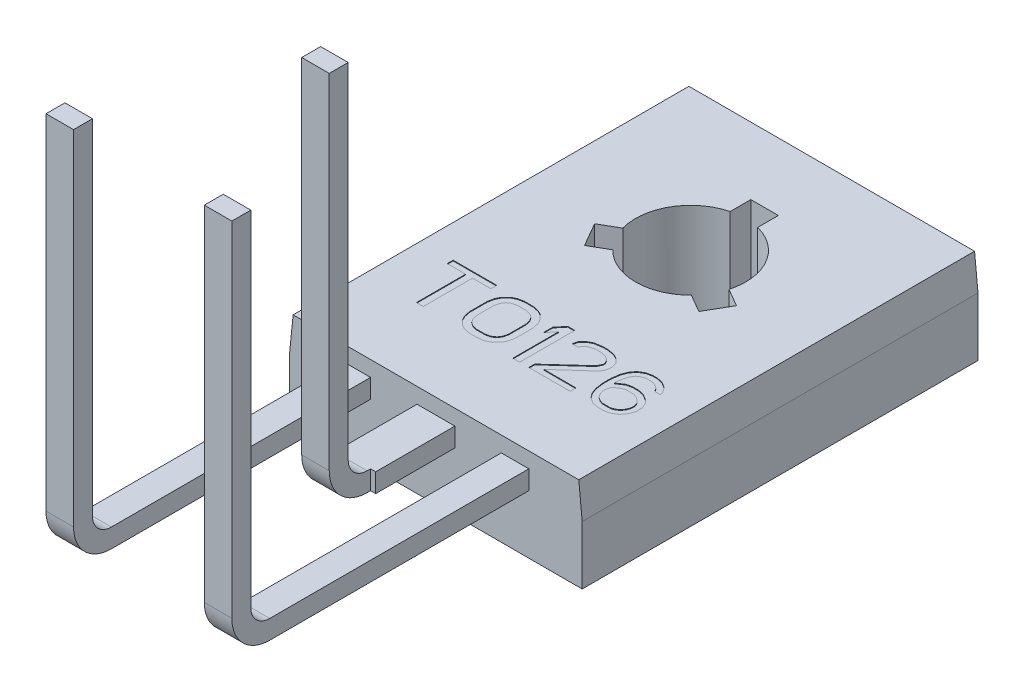
from build123d import *

# Parameters (mm, degrees)
CORTAR_EXTRUIR1_START         = -2.25
CORTAR_EXTRUIR1_OUTLINE_W     = 8.5
CORTAR_EXTRUIR1_OUTLINE_H     = 11.5
CORTAR_EXTRUIR1_DEPTH         = 2.68
CORTAR_EXTRUIR1_START_2       = -0.55
CORTAR_EXTRUIR1_2_OUTLINE_W   = 0.8
CORTAR_EXTRUIR1_2_OUTLINE_H   = 15.8
CORTAR_EXTRUIR1_2_OUTLINE_W_2 = 1.1
CORTAR_EXTRUIR1_2_OUTLINE_H_2 = 2.3
CORTAR_EXTRUIR1_2_DEPTH       = 0.55
CORTAR_EXTRUIR1_START_3       = -2.27
CORTAR_EXTRUIR1_3_OUTLINE_W   = 6.9
CORTAR_EXTRUIR1_3_OUTLINE_H   = 8.7
CORTAR_EXTRUIR1_3_DEPTH       = 2.72
CORTAR_EXTRUIR1_4_DEPTH       = 0.7
CORTAR_EXTRUIR1_START_4       = 0.43
CORTAR_EXTRUIR1_5_OUTLINE_W   = 8.5
CORTAR_EXTRUIR1_5_OUTLINE_H   = 11.5
CORTAR_EXTRUIR1_5_OUTLINE_W_2 = 6.9
CORTAR_EXTRUIR1_5_OUTLINE_H_2 = 8.7
CORTAR_EXTRUIR1_5_DEPTH       = 0.02
CORTAR_EXTRUIR1_6_DEPTH       = 0.02
CORTAR_EXTRUIR1_START_5       = -12
CORTAR_EXTRUIR1_7_DEPTH       = 13
CROQUIS4_W                    = 5.4
CROQUIS4_H                    = 11.5
CORTAR_EXTRUIR2_DEPTH         = 17.518335267
SALIENTE_EXTRUIR2_DEPTH       = 0.4
SALIENTE_EXTRUIR3_DEPTH       = 0.4
SALIENTE_EXTRUIR4_DEPTH       = 0.4


with BuildPart() as part:
    # Cortar-Extruir1: read off the stored shape, not the designer's step
    # Cortar-Extruir1 outline → Cortar-Extruir1 (new body)
    with BuildSketch(Plane(origin=(0, 2.25, 0), x_dir=(1, 0, 0), z_dir=(0, 1, 0)).offset(CORTAR_EXTRUIR1_START)):
        with Locations((0, 5.75)):
            Rectangle(CORTAR_EXTRUIR1_OUTLINE_W, CORTAR_EXTRUIR1_OUTLINE_H)
        with BuildLine():
            Line((-1.661256029, 5.978993169), (-2.061256029, 6.671813492))
            Line((-2.061256029, 6.671813492), (-1.541640786, 6.971813492))
            ThreePointArc((-1.541640786, 6.971813492), (-1.385640646, 8.2), (-0.4, 8.949193338))
            Line((-0.4, 8.949193338), (-0.4, 9.549193338))
            Line((-0.4, 9.549193338), (0.4, 9.549193338))
            Line((0.4, 9.549193338), (0.4, 8.949193338))
            ThreePointArc((0.4, 8.949193338), (1.385640646, 8.2), (1.541640786, 6.971813492))
            Line((1.541640786, 6.971813492), (2.061256029, 6.671813492))
            Line((2.061256029, 6.671813492), (1.661256029, 5.978993169))
            Line((1.661256029, 5.978993169), (1.141640787, 6.278993169))
            ThreePointArc((1.141640787, 6.278993169), (0, 5.8), (-1.141640787, 6.278993169))
            Line((-1.141640787, 6.278993169), (-1.661256029, 5.978993169))
        make_face(mode=Mode.SUBTRACT)
    extrude(amount=CORTAR_EXTRUIR1_DEPTH)

    # Cortar-Extruir1 2 outline → Cortar-Extruir1 2 (add)
    with BuildSketch(Plane(origin=(0, 2.25, 0), x_dir=(1, 0, 0), z_dir=(0, 1, 0)).offset(CORTAR_EXTRUIR1_START_2)):
        with Locations((-2.3, -7.9)):
            Rectangle(CORTAR_EXTRUIR1_2_OUTLINE_W, CORTAR_EXTRUIR1_2_OUTLINE_H)
        with Locations((0, -1.15)):
            Rectangle(CORTAR_EXTRUIR1_2_OUTLINE_W_2, CORTAR_EXTRUIR1_2_OUTLINE_H_2)
        with Locations((2.3, -7.9)):
            Rectangle(CORTAR_EXTRUIR1_2_OUTLINE_W, CORTAR_EXTRUIR1_2_OUTLINE_H)
    extrude(amount=CORTAR_EXTRUIR1_2_DEPTH)

    # Cortar-Extruir1 3 outline → Cortar-Extruir1 3 (add)
    # profile 1 of 3: a face of its own
    with BuildSketch(Plane(origin=(0, 2.25, 0), x_dir=(1, 0, 0), z_dir=(0, 1, 0)).offset(CORTAR_EXTRUIR1_START_3)):
        with Locations((0, 6.35)):
            Rectangle(CORTAR_EXTRUIR1_3_OUTLINE_W, CORTAR_EXTRUIR1_3_OUTLINE_H)
        Polygon((-1.933333302, 3.7), (-1.933333302, 3.529787254), (-2.466666651, 3.529787254), (-2.466666651, 2.1), (-2.666666651, 2.1), (-2.666666651, 3.529787254), (-3.2, 3.529787254), (-3.2, 3.7), align=None, mode=Mode.SUBTRACT)
        Polygon((-1.133333397, 3.7), (-0.866666603, 3.7), (-0.7, 3.665957451), (-0.566666603, 3.597872353), (-0.433333397, 3.461702156), (-0.366666603, 3.32553196), (-0.333333397, 3.155319118), (-0.333333397, 2.644680834), (-0.366666603, 2.474468088), (-0.433333397, 2.338297868), (-0.566666603, 2.202127659), (-0.7, 2.134042552), (-0.866666603, 2.1), (-1.133333397, 2.1), (-1.3, 2.134042552), (-1.433333397, 2.202127659), (-1.566666603, 2.338297868), (-1.633333302, 2.474468088), (-1.666666698, 2.644680834), (-1.666666698, 3.155319118), (-1.633333302, 3.32553196), (-1.566666603, 3.461702156), (-1.433333397, 3.597872353), (-1.3, 3.665957451), align=None, mode=Mode.SUBTRACT)
        Polygon((0.333333206, 2.1), (0.133333206, 2.1), (0.133333206, 3.427659607), (-0.066666603, 3.189361668), (-0.066666603, 3.461702156), (0.133333206, 3.7), (0.333333206, 3.7), align=None, mode=Mode.SUBTRACT)
        Polygon((0.6, 2.27021277), (1.533333206, 3.121276569), (1.6, 3.257446766), (1.6, 3.32553196), (1.533333206, 3.427659607), (1.433333206, 3.495744705), (1.266666794, 3.529787254), (1.133333206, 3.529787254), (0.966666794, 3.495744705), (0.866666794, 3.427659607), (0.8, 3.32553196), (0.633333206, 3.32553196), (0.666666794, 3.461702156), (0.8, 3.597872353), (0.933333206, 3.665957451), (1.166666794, 3.7), (1.3, 3.7), (1.5, 3.665957451), (1.633333206, 3.597872353), (1.766666794, 3.461702156), (1.8, 3.32553196), (1.8, 3.257446766), (1.766666794, 3.121276569), (1.7, 3.019148922), (0.866666794, 2.27021277), (1.8, 2.27021277), (1.8, 2.1), (0.6, 2.1), align=None, mode=Mode.SUBTRACT)
        Polygon((3.2, 2.882978725), (3.266666412, 2.71276598), (3.266666412, 2.542553186), (3.2, 2.372340417), (3.1, 2.236170208), (2.933333206, 2.134042552), (2.766666794, 2.1), (2.6, 2.1), (2.433333206, 2.134042552), (2.266666794, 2.236170208), (2.166666794, 2.372340417), (2.1, 2.542553186), (2.066666794, 2.780851078), (2.066666794, 3.019148922), (2.1, 3.257446766), (2.166666794, 3.427659607), (2.266666794, 3.563829803), (2.433333206, 3.665957451), (2.6, 3.7), (2.733333206, 3.7), (2.9, 3.665957451), (3.066666794, 3.563829803), (3.166666794, 3.427659607), (3.2, 3.32553196), (3.033333206, 3.32553196), (2.966666794, 3.427659607), (2.866666794, 3.495744705), (2.766666794, 3.529787254), (2.566666794, 3.529787254), (2.466666794, 3.495744705), (2.366666794, 3.427659607), (2.3, 3.32553196), (2.266666794, 3.223404217), (2.233333206, 3.019148922), (2.233333206, 2.951063824), (2.433333206, 3.08723402), (2.6, 3.121276569), (2.766666794, 3.121276569), (2.933333206, 3.08723402), (3.1, 2.985106373), align=None, mode=Mode.SUBTRACT)
        with BuildLine():
            Line((-1.661256029, 5.978993169), (-2.061256029, 6.671813492))
            Line((-2.061256029, 6.671813492), (-1.985357107, 6.715633755))
            ThreePointArc((-1.985357107, 6.715633755), (-1.818653348, 8.45), (-0.4, 9.461552813))
            Line((-0.4, 9.461552813), (-0.4, 9.549193338))
            Line((-0.4, 9.549193338), (0.4, 9.549193338))
            Line((0.4, 9.549193338), (0.4, 9.461552813))
            ThreePointArc((0.4, 9.461552813), (1.818653348, 8.45), (1.985357107, 6.715633755))
            Line((1.985357107, 6.715633755), (2.061256029, 6.671813492))
            Line((2.061256029, 6.671813492), (1.661256029, 5.978993169))
            Line((1.661256029, 5.978993169), (1.585357107, 6.022813432))
            ThreePointArc((1.585357107, 6.022813432), (0, 5.3), (-1.585357107, 6.022813432))
            Line((-1.585357107, 6.022813432), (-1.661256029, 5.978993169))
        make_face(mode=Mode.SUBTRACT)
    # profile 2 of 3: a face of its own
    with BuildSketch(Plane(origin=(0, 2.25, 0), x_dir=(1, 0, 0), z_dir=(0, 1, 0)).offset(CORTAR_EXTRUIR1_START_3)):
        Polygon((-0.733333397, 3.461702156), (-0.866666603, 3.495744705), (-1.133333397, 3.495744705), (-1.266666603, 3.461702156), (-1.366666603, 3.393617058), (-1.433333397, 3.291489315), (-1.466666603, 3.155319119), (-1.466666603, 2.644680834), (-1.433333397, 2.508510637), (-1.366666603, 2.40638299), (-1.266666603, 2.338297868), (-1.133333397, 2.304255319), (-0.866666603, 2.304255319), (-0.733333397, 2.338297868), (-0.633333397, 2.40638299), (-0.566666603, 2.508510637), (-0.533333397, 2.644680834), (-0.533333397, 3.155319119), (-0.566666603, 3.291489315), (-0.633333397, 3.393617058), align=None)
    # profile 3 of 3: a face of its own
    with BuildSketch(Plane(origin=(0, 2.25, 0), x_dir=(1, 0, 0), z_dir=(0, 1, 0)).offset(CORTAR_EXTRUIR1_START_3)):
        Polygon((3.1, 2.576595736), (3.1, 2.678723383), (3.066666794, 2.780851078), (3, 2.848936176), (2.9, 2.917021275), (2.8, 2.951063824), (2.566666794, 2.951063824), (2.466666794, 2.917021275), (2.366666794, 2.848936176), (2.3, 2.780851078), (2.266666794, 2.678723383), (2.266666794, 2.576595736), (2.3, 2.474468088), (2.366666794, 2.372340417), (2.466666794, 2.304255319), (2.566666794, 2.27021277), (2.8, 2.27021277), (2.9, 2.304255319), (3, 2.372340417), (3.066666794, 2.474468088), align=None)
    extrude(amount=CORTAR_EXTRUIR1_3_DEPTH)

    # Cortar-Extruir1 4 outline → Cortar-Extruir1 4 (add)
    with BuildSketch(Plane(origin=(0, 2.25, 0), x_dir=(1, 0, 0), z_dir=(0, 1, 0)).offset(CORTAR_EXTRUIR1_START)):
        with BuildLine():
            Line((-2.061256029, 6.671813492), (-1.661256029, 5.978993169))
            Line((-1.661256029, 5.978993169), (-1.141640787, 6.278993169))
            ThreePointArc((-1.141640787, 6.278993169), (-1.385640646, 6.6), (-1.541640786, 6.971813492))
            Line((-1.541640786, 6.971813492), (-2.061256029, 6.671813492))
        make_face()
        with BuildLine():
            Line((-0.4, 9.549193338), (-0.4, 8.949193338))
            ThreePointArc((-0.4, 8.949193338), (0, 9), (0.4, 8.949193338))
            Line((0.4, 8.949193338), (0.4, 9.549193338))
            Line((0.4, 9.549193338), (-0.4, 9.549193338))
        make_face()
        with BuildLine():
            Line((1.141640787, 6.278993169), (1.661256029, 5.978993169))
            Line((1.661256029, 5.978993169), (2.061256029, 6.671813492))
            Line((2.061256029, 6.671813492), (1.541640786, 6.971813492))
            ThreePointArc((1.541640786, 6.971813492), (1.385640646, 6.6), (1.141640787, 6.278993169))
        make_face()
    extrude(amount=CORTAR_EXTRUIR1_4_DEPTH)

    # Cortar-Extruir1 5 outline → Cortar-Extruir1 5 (add)
    # profile 1 of 4: a face of its own
    with BuildSketch(Plane(origin=(0, 2.25, 0), x_dir=(1, 0, 0), z_dir=(0, 1, 0)).offset(CORTAR_EXTRUIR1_START_4)):
        with Locations((0, 5.75)):
            Rectangle(CORTAR_EXTRUIR1_5_OUTLINE_W, CORTAR_EXTRUIR1_5_OUTLINE_H)
        with Locations((0, 6.35)):
            Rectangle(CORTAR_EXTRUIR1_5_OUTLINE_W_2, CORTAR_EXTRUIR1_5_OUTLINE_H_2, mode=Mode.SUBTRACT)
    # profile 2 of 4: a face of its own
    with BuildSketch(Plane(origin=(0, 2.25, 0), x_dir=(1, 0, 0), z_dir=(0, 1, 0)).offset(CORTAR_EXTRUIR1_START_4)):
        with BuildLine():
            ThreePointArc((-0.4, 9.461552813), (-1.818653348, 8.45), (-1.985357107, 6.715633755))
            Line((-1.985357107, 6.715633755), (-1.541640786, 6.971813492))
            ThreePointArc((-1.541640786, 6.971813492), (-1.385640646, 8.2), (-0.4, 8.949193338))
            Line((-0.4, 8.949193338), (-0.4, 9.461552813))
        make_face()
    # profile 3 of 4: a face of its own
    with BuildSketch(Plane(origin=(0, 2.25, 0), x_dir=(1, 0, 0), z_dir=(0, 1, 0)).offset(CORTAR_EXTRUIR1_START_4)):
        with BuildLine():
            Line((-1.141640787, 6.278993169), (-1.585357107, 6.022813432))
            ThreePointArc((-1.585357107, 6.022813432), (0, 5.3), (1.585357107, 6.022813432))
            Line((1.585357107, 6.022813432), (1.141640787, 6.278993169))
            ThreePointArc((1.141640787, 6.278993169), (0, 5.8), (-1.141640787, 6.278993169))
        make_face()
    # profile 4 of 4: a face of its own
    with BuildSketch(Plane(origin=(0, 2.25, 0), x_dir=(1, 0, 0), z_dir=(0, 1, 0)).offset(CORTAR_EXTRUIR1_START_4)):
        with BuildLine():
            ThreePointArc((1.985357107, 6.715633755), (1.818653348, 8.45), (0.4, 9.461552813))
            Line((0.4, 9.461552813), (0.4, 8.949193338))
            ThreePointArc((0.4, 8.949193338), (1.385640646, 8.2), (1.541640786, 6.971813492))
            Line((1.541640786, 6.971813492), (1.985357107, 6.715633755))
        make_face()
    extrude(amount=CORTAR_EXTRUIR1_5_DEPTH)

    # Cortar-Extruir1 6 outline → Cortar-Extruir1 6 (add)
    # profile 1 of 8: a face of its own
    with BuildSketch(Plane(origin=(0, 2.25, 0), x_dir=(1, 0, 0), z_dir=(0, 1, 0)).offset(CORTAR_EXTRUIR1_START_3)):
        with BuildLine():
            Line((-1.985357107, 6.715633755), (-2.061256029, 6.671813492))
            Line((-2.061256029, 6.671813492), (-1.661256029, 5.978993169))
            Line((-1.661256029, 5.978993169), (-1.585357107, 6.022813432))
            ThreePointArc((-1.585357107, 6.022813432), (-1.818653348, 6.35), (-1.985357107, 6.715633755))
        make_face()
    # profile 2 of 8: a face of its own
    with BuildSketch(Plane(origin=(0, 2.25, 0), x_dir=(1, 0, 0), z_dir=(0, 1, 0)).offset(CORTAR_EXTRUIR1_START_3)):
        with BuildLine():
            Line((-0.4, 9.549193338), (-0.4, 9.461552813))
            ThreePointArc((-0.4, 9.461552813), (0, 9.5), (0.4, 9.461552813))
            Line((0.4, 9.461552813), (0.4, 9.549193338))
            Line((0.4, 9.549193338), (-0.4, 9.549193338))
        make_face()
    # profile 3 of 8: a face of its own
    with BuildSketch(Plane(origin=(0, 2.25, 0), x_dir=(1, 0, 0), z_dir=(0, 1, 0)).offset(CORTAR_EXTRUIR1_START_3)):
        with BuildLine():
            ThreePointArc((1.985357107, 6.715633755), (1.818653348, 6.35), (1.585357107, 6.022813432))
            Line((1.585357107, 6.022813432), (1.661256029, 5.978993169))
            Line((1.661256029, 5.978993169), (2.061256029, 6.671813492))
            Line((2.061256029, 6.671813492), (1.985357107, 6.715633755))
        make_face()
    # profile 4 of 8: a face of its own
    with BuildSketch(Plane(origin=(0, 2.25, 0), x_dir=(1, 0, 0), z_dir=(0, 1, 0)).offset(CORTAR_EXTRUIR1_START_3)):
        Polygon((-2.466666651, 3.529787254), (-1.933333302, 3.529787254), (-1.933333302, 3.7), (-3.2, 3.7), (-3.2, 3.529787254), (-2.666666651, 3.529787254), (-2.666666651, 2.1), (-2.466666651, 2.1), align=None)
    # profile 5 of 8: a face of its own
    with BuildSketch(Plane(origin=(0, 2.25, 0), x_dir=(1, 0, 0), z_dir=(0, 1, 0)).offset(CORTAR_EXTRUIR1_START_3)):
        Polygon((-0.7, 3.665957451), (-0.866666603, 3.7), (-1.133333397, 3.7), (-1.3, 3.665957451), (-1.433333397, 3.597872353), (-1.566666603, 3.461702156), (-1.633333302, 3.32553196), (-1.666666698, 3.155319118), (-1.666666698, 2.644680834), (-1.633333302, 2.474468088), (-1.566666603, 2.338297868), (-1.433333397, 2.202127659), (-1.3, 2.134042552), (-1.133333397, 2.1), (-0.866666603, 2.1), (-0.7, 2.134042552), (-0.566666603, 2.202127659), (-0.433333397, 2.338297868), (-0.366666603, 2.474468088), (-0.333333397, 2.644680834), (-0.333333397, 3.155319119), (-0.366666603, 3.32553196), (-0.433333397, 3.461702156), (-0.566666603, 3.597872353), align=None)
        Polygon((-1.133333397, 3.495744705), (-0.866666603, 3.495744705), (-0.733333397, 3.461702156), (-0.633333397, 3.393617058), (-0.566666603, 3.291489315), (-0.533333397, 3.155319118), (-0.533333397, 2.644680834), (-0.566666603, 2.508510637), (-0.633333397, 2.40638299), (-0.733333397, 2.338297868), (-0.866666603, 2.304255319), (-1.133333397, 2.304255319), (-1.266666603, 2.338297868), (-1.366666603, 2.40638299), (-1.433333397, 2.508510637), (-1.466666603, 2.644680834), (-1.466666603, 3.155319119), (-1.433333397, 3.291489315), (-1.366666603, 3.393617058), (-1.266666603, 3.461702156), align=None, mode=Mode.SUBTRACT)
    # profile 6 of 8: a face of its own
    with BuildSketch(Plane(origin=(0, 2.25, 0), x_dir=(1, 0, 0), z_dir=(0, 1, 0)).offset(CORTAR_EXTRUIR1_START_3)):
        Polygon((0.133333206, 3.427659607), (0.133333206, 2.1), (0.333333206, 2.1), (0.333333206, 3.7), (0.133333206, 3.7), (-0.066666603, 3.461702156), (-0.066666603, 3.189361668), align=None)
    # profile 7 of 8: a face of its own
    with BuildSketch(Plane(origin=(0, 2.25, 0), x_dir=(1, 0, 0), z_dir=(0, 1, 0)).offset(CORTAR_EXTRUIR1_START_3)):
        Polygon((1.6, 3.257446766), (1.533333206, 3.121276569), (0.6, 2.27021277), (0.6, 2.1), (1.8, 2.1), (1.8, 2.27021277), (0.866666794, 2.27021277), (1.7, 3.019148922), (1.766666794, 3.121276569), (1.8, 3.257446766), (1.8, 3.32553196), (1.766666794, 3.461702156), (1.633333206, 3.597872353), (1.5, 3.665957451), (1.3, 3.7), (1.166666794, 3.7), (0.933333206, 3.665957451), (0.8, 3.597872353), (0.666666794, 3.461702156), (0.633333206, 3.32553196), (0.8, 3.32553196), (0.866666794, 3.427659607), (0.966666794, 3.495744705), (1.133333206, 3.529787254), (1.266666794, 3.529787254), (1.433333206, 3.495744705), (1.533333206, 3.427659607), (1.6, 3.32553196), align=None)
    # profile 8 of 8: a face of its own
    with BuildSketch(Plane(origin=(0, 2.25, 0), x_dir=(1, 0, 0), z_dir=(0, 1, 0)).offset(CORTAR_EXTRUIR1_START_3)):
        Polygon((3.266666412, 2.542553186), (3.266666412, 2.71276598), (3.2, 2.882978725), (3.1, 2.985106373), (2.933333206, 3.08723402), (2.766666794, 3.121276569), (2.6, 3.121276569), (2.433333206, 3.08723402), (2.233333206, 2.951063824), (2.233333206, 3.019148922), (2.266666794, 3.223404217), (2.3, 3.32553196), (2.366666794, 3.427659607), (2.466666794, 3.495744705), (2.566666794, 3.529787254), (2.766666794, 3.529787254), (2.866666794, 3.495744705), (2.966666794, 3.427659607), (3.033333206, 3.32553196), (3.2, 3.32553196), (3.166666794, 3.427659607), (3.066666794, 3.563829803), (2.9, 3.665957451), (2.733333206, 3.7), (2.6, 3.7), (2.433333206, 3.665957451), (2.266666794, 3.563829803), (2.166666794, 3.427659607), (2.1, 3.257446766), (2.066666794, 3.019148922), (2.066666794, 2.780851078), (2.1, 2.542553186), (2.166666794, 2.372340417), (2.266666794, 2.236170208), (2.433333206, 2.134042552), (2.6, 2.1), (2.766666794, 2.1), (2.933333206, 2.134042552), (3.1, 2.236170208), (3.2, 2.372340417), align=None)
        Polygon((3.066666794, 2.780851078), (3.1, 2.678723383), (3.1, 2.576595736), (3.066666794, 2.474468088), (3, 2.372340417), (2.9, 2.304255319), (2.8, 2.27021277), (2.566666794, 2.27021277), (2.466666794, 2.304255319), (2.366666794, 2.372340417), (2.3, 2.474468088), (2.266666794, 2.576595736), (2.266666794, 2.678723383), (2.3, 2.780851078), (2.366666794, 2.848936176), (2.466666794, 2.917021275), (2.566666794, 2.951063824), (2.8, 2.951063824), (2.9, 2.917021275), (3, 2.848936176), align=None, mode=Mode.SUBTRACT)
    extrude(amount=CORTAR_EXTRUIR1_6_DEPTH)

    # Cortar-Extruir1 7 outline → Cortar-Extruir1 7 (cut)
    with BuildSketch(Plane.XY.offset(CORTAR_EXTRUIR1_START_5)):
        Polygon((4.25, 2.7), (4.15, 2.7), (4.25, 1.7), align=None)
        Polygon((-4.25, 1.7), (-4.15, 2.7), (-4.25, 2.7), align=None)
    extrude(amount=CORTAR_EXTRUIR1_7_DEPTH, mode=Mode.SUBTRACT)

    # Croquis4 → Cortar-Extruir2 (cut, through all)
    with BuildSketch(Plane(origin=(0, 2.25, 0), x_dir=(1, 0, 0), z_dir=(0, 1, 0))):
        with Locations((0, -10.05)):
            Rectangle(CROQUIS4_W, CROQUIS4_H)
    extrude(amount=-CORTAR_EXTRUIR2_DEPTH, mode=Mode.SUBTRACT)

    # Croquis3 → Saliente-Extruir2 (add, symmetric)
    with BuildSketch(Plane(origin=(0, 0, 0), x_dir=(0, 0, -1), z_dir=(1, 0, 0))):
        with BuildLine():
            Line((-2.3, 1.7), (-2.4, 1.7))
            ThreePointArc((-2.4, 1.7), (-3.177817459, 2.022182541), (-3.5, 2.8))
            Line((-3.5, 2.8), (-3.5, 12.8))
            Line((-3.5, 12.8), (-2.95, 12.8))
            Line((-2.95, 12.8), (-2.95, 2.8))
            ThreePointArc((-2.95, 2.8), (-2.78890873, 2.41109127), (-2.4, 2.25))
            Line((-2.4, 2.25), (-2.3, 2.25))
            Line((-2.3, 2.25), (-2.3, 1.7))
        make_face()
    extrude(amount=SALIENTE_EXTRUIR2_DEPTH, both=True)

    # Croquis5 → Saliente-Extruir3 (add, symmetric)
    with BuildSketch(Plane(origin=(-2.3, 0, 0), x_dir=(0, 0, -1), z_dir=(1, 0, 0))):
        with BuildLine():
            Line((-4.3, 2.25), (-7.53, 2.25))
            ThreePointArc((-7.53, 2.25), (-7.91890873, 2.41109127), (-8.08, 2.8))
            Line((-8.08, 2.8), (-8.08, 12.8))
            Line((-8.08, 12.8), (-8.63, 12.8))
            Line((-8.63, 12.8), (-8.63, 2.8))
            ThreePointArc((-8.63, 2.8), (-8.307817459, 2.022182541), (-7.53, 1.7))
            Line((-7.53, 1.7), (-4.3, 1.7))
            Line((-4.3, 1.7), (-4.3, 2.25))
        make_face()
    extrude(amount=SALIENTE_EXTRUIR3_DEPTH, both=True)

    # Croquis6 → Saliente-Extruir4 (add, symmetric)
    with BuildSketch(Plane(origin=(2.3, 0, 0), x_dir=(0, 0, -1), z_dir=(1, 0, 0))):
        with BuildLine():
            Line((-4.3, 2.25), (-7.53, 2.25))
            ThreePointArc((-7.53, 2.25), (-7.91890873, 2.41109127), (-8.08, 2.8))
            Line((-8.08, 2.8), (-8.08, 12.8))
            Line((-8.08, 12.8), (-8.63, 12.8))
            Line((-8.63, 12.8), (-8.63, 2.8))
            ThreePointArc((-8.63, 2.8), (-8.307817459, 2.022182541), (-7.53, 1.7))
            Line((-7.53, 1.7), (-4.3, 1.7))
            Line((-4.3, 1.7), (-4.3, 2.25))
        make_face()
    extrude(amount=SALIENTE_EXTRUIR4_DEPTH, both=True)


solid = part.part
